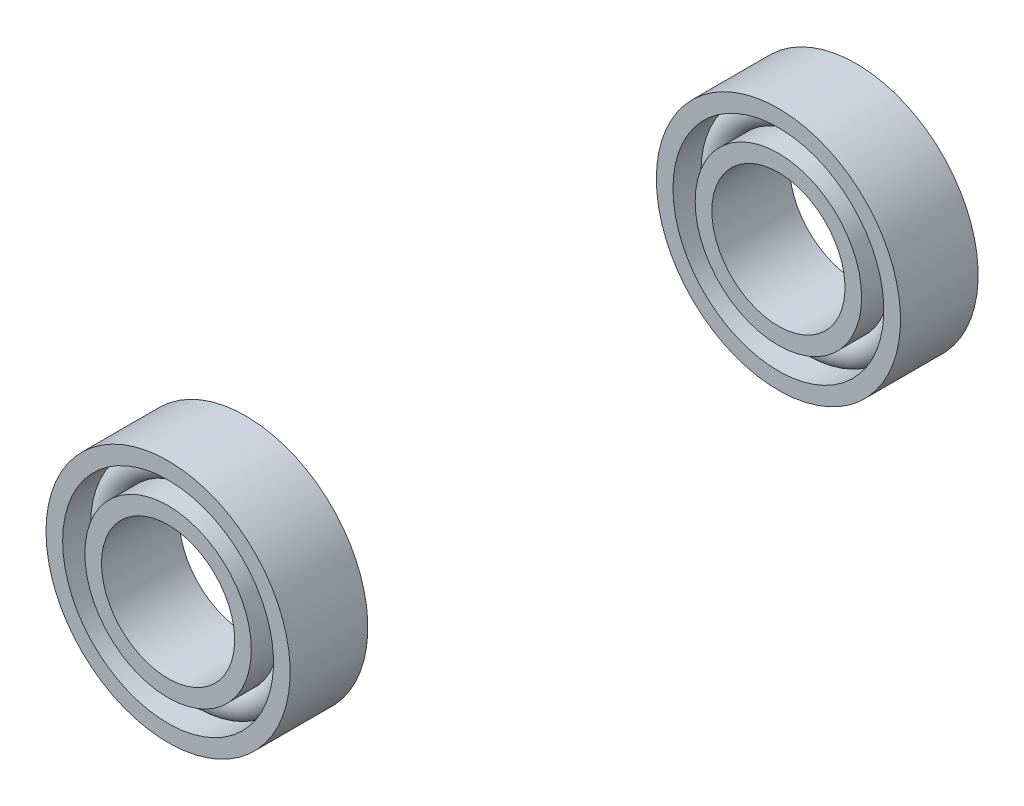
from build123d import *

# Parameters (mm, degrees)
SK_PISTA_INT_1_W = 1.5
SK_PISTA_INT_1_H = 7
SK_PISTA_EXT_1_W = 1.5
SK_PISTA_EXT_1_H = 7
SK_BOLAS_1_R     = 1.4
SK_PISTA_INT_2_W = 1.5
SK_PISTA_INT_2_H = 7
SK_PISTA_EXT_2_W = 1.5
SK_PISTA_EXT_2_H = 7
SK_BOLAS_2_R     = 1.4


with BuildPart() as part:
    # Sk_Pista_int_1 → Pista_int_1 (revolve)
    with BuildSketch(Plane(origin=(0, 0, 0), x_dir=(1, 0, 0), z_dir=(0, 1, 0))):
        with Locations((179.25, -88)):
            Rectangle(SK_PISTA_INT_1_W, SK_PISTA_INT_1_H)
    revolve(axis=Axis((172.5, 0, 79.5), (0, 0, 1)))



with BuildPart() as body_2:
    # Sk_Pista_ext_1 → Pista_ext_1 (revolve)
    with BuildSketch(Plane(origin=(0, 0, 0), x_dir=(1, 0, 0), z_dir=(0, 1, 0))):
        with Locations((182.75, -88)):
            Rectangle(SK_PISTA_EXT_1_W, SK_PISTA_EXT_1_H)
    revolve(axis=Axis((172.5, 0, 79.5), (0, 0, 1)))


with BuildPart() as part_1:
    add(part.part)

    add(body_2.part)  # Bolas_1 merges body 2
    # Sk_Bolas_1 → Bolas_1 (revolve)
    with BuildSketch(Plane(origin=(0, 0, 0), x_dir=(1, 0, 0), z_dir=(0, 1, 0))):
        with Locations((181, -88)):
            Circle(SK_BOLAS_1_R)
    revolve(axis=Axis((172.5, 0, 83), (0, 0, 1)))


with BuildPart() as body_2_2:
    # Sk_Pista_int_2 → Pista_int_2 (revolve)
    with BuildSketch(Plane(origin=(0, 0, 0), x_dir=(1, 0, 0), z_dir=(0, 1, 0))):
        with Locations((179.25, -143)):
            Rectangle(SK_PISTA_INT_2_W, SK_PISTA_INT_2_H)
    revolve(axis=Axis((172.5, 0, 134.5), (0, 0, 1)))



with BuildPart() as body_3:
    # Sk_Pista_ext_2 → Pista_ext_2 (revolve)
    with BuildSketch(Plane(origin=(0, 0, 0), x_dir=(1, 0, 0), z_dir=(0, 1, 0))):
        with Locations((182.75, -143)):
            Rectangle(SK_PISTA_EXT_2_W, SK_PISTA_EXT_2_H)
    revolve(axis=Axis((172.5, 0, 134.5), (0, 0, 1)))


with BuildPart() as body_2_2_1:
    add(body_2_2.part)

    add(body_3.part)  # Bolas_2 merges body 3
    # Sk_Bolas_2 → Bolas_2 (revolve)
    with BuildSketch(Plane(origin=(0, 0, 0), x_dir=(1, 0, 0), z_dir=(0, 1, 0))):
        with Locations((181, -143)):
            Circle(SK_BOLAS_2_R)
    revolve(axis=Axis((172.5, 0, 138), (0, 0, 1)))


solid = Compound([part_1.part, body_2_2_1.part])
